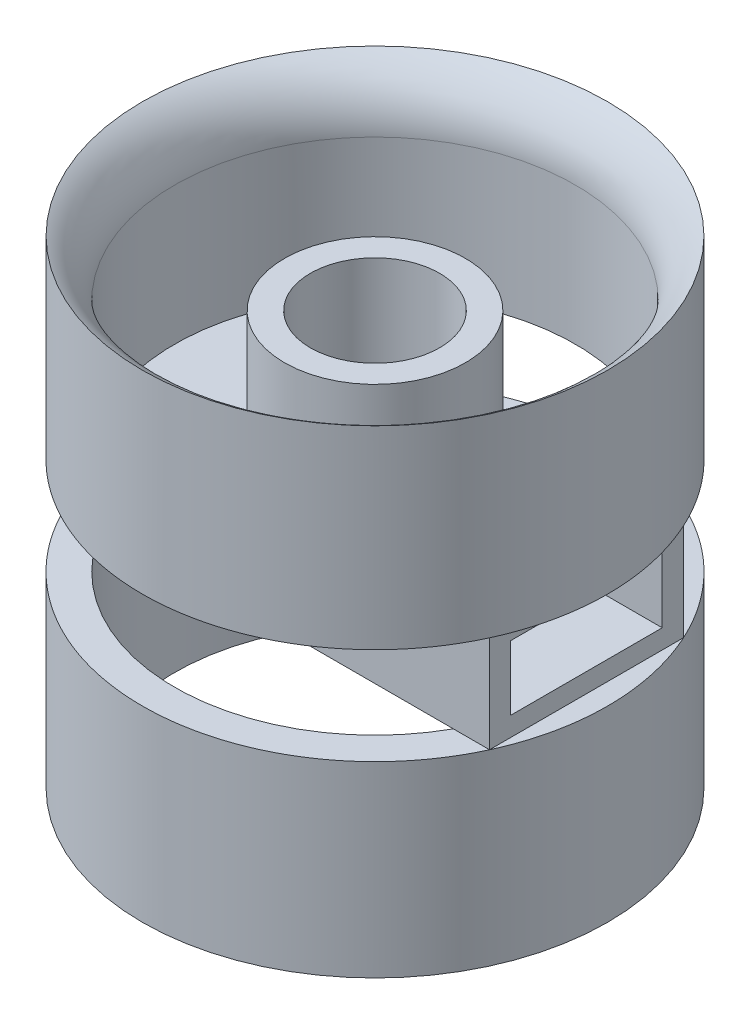
from build123d import *

# Parameters (mm, degrees)
SKETCH_1_R          = 36
EXTRUDE_1_DEPTH     = 30
SKETCH_2_R          = 31
CUT_EXTRUDE_1_DEPTH = 30
FILLET_1_R          = 10
SKETCH_11_W         = 65.4474843869366
SKETCH_11_H         = 30.000000000000004
EXTRUDE_8_DEPTH     = 15
CUT_EXTRUDE_3_DEPTH = 84.18024249227881
CUT_EXTRUDE_4_DEPTH = 58.00000000000003
SKETCH_21_R         = 14
EXTRUDE_10_DEPTH    = 20
SKETCH_22_R         = 10
CUT_EXTRUDE_5_DEPTH = 20
EXTRUDE_START       = 29.000000000000004
SKETCH_23_R         = 36
EXTRUDE_11_DEPTH    = 29.000000000000004
CUT_EXTRUDE_START   = -29
SKETCH_24_R         = 31
CUT_EXTRUDE_7_DEPTH = 29


with BuildPart() as part:
    # 草圖1 → 填料-伸長1 (new body)
    with BuildSketch(Plane(origin=(0, 0, 0), x_dir=(1, 0, 0), z_dir=(0, 1, 0))):
        with Locations(Location((0, 0, 0), (0, 0, 270))):
            Circle(SKETCH_1_R)
    extrude(amount=EXTRUDE_1_DEPTH)

    # 草圖2 → 除料-伸長1 (cut)
    with BuildSketch(Plane(origin=(0, 30, 0), x_dir=(1, 0, 0), z_dir=(0, 1, 0))):
        with Locations(Location((0, 0, 0), (0, 0, 270))):
            Circle(SKETCH_2_R)
    extrude(amount=-CUT_EXTRUDE_1_DEPTH, mode=Mode.SUBTRACT)

    # 圓角1
    # the kernel refuses this fillet: 10 mm, written as the material it takes off along each edge
    with BuildSketch(Plane(origin=(0, 30, 0), x_dir=(-1.8e-16, 0, 1), z_dir=(-1, 0, -1.8e-16))) as fillet_1_piece_1:
        with BuildLine():
            CenterArc((41, -8.660254037844858), FILLET_1_R, 119.99999999999864, 60.000000000001364)
            Line((31.000000000000004, -8.660254037844858), (30.800000000000004, -8.660254037844858))
            Line((30.800000000000004, -8.660254037844858), (30.8, 0))
            Line((30.8, 0), (31, 0.1999999999999993))
            ThreePointArc((31, 0.1999999999999993), (33.5000000000001, 0.1999999999999993), (35.90000000000021, 0.17320508075653507))
            Line((35.90000000000021, 0.17320508075653507), (36.000000000000206, -3.5527e-13))
        make_face()
    revolve(axis=Axis((0, 30, 0), (0, 1, 0)), mode=Mode.SUBTRACT)

    # 草圖11 → 填料-伸長8 (add)
    with BuildSketch(Plane(origin=(0, 0, 0), x_dir=(1, 0, 0), z_dir=(0, 1, 0))):
        Rectangle(SKETCH_11_W, SKETCH_11_H)
    extrude(amount=-EXTRUDE_8_DEPTH)

    # 草圖16 → 除料-伸長3 (cut, through all)
    with BuildSketch(Plane.ZY.offset(32.7237421934683)):
        Polygon((-11.724999999999989, -2.02034535171655), (11.725000000000014, -2.02034535171655), (11.725000000000014, -12.02034535171655), (-11.724999999999985, -12.02034535171655), align=None)
    extrude(amount=-CUT_EXTRUDE_3_DEPTH, mode=Mode.SUBTRACT)

    # 草圖19 → 除料-伸長4 (cut)
    with BuildSketch(Plane.ZY.offset(32.7237421934683)):
        Polygon((-11.72500000000632, -6.624703450403075), (-12.725000000017417, -6.624703450403075), (-12.725000000017417, -5.624703450403075), (-13.725000000017417, -5.624703450403075), (-13.725000000017417, -8.624839762103937), (-12.725000000017417, -8.624839762103937), (-12.725000000017417, -7.624703450403074), (-11.72500000000632, -7.624703450403074), align=None)
    extrude(amount=-CUT_EXTRUDE_4_DEPTH, mode=Mode.SUBTRACT)

    # 草圖21 → 填料-伸長10 (add)
    with BuildSketch(Plane(origin=(0, 0, 0), x_dir=(1, 0, 0), z_dir=(0, 1, 0))):
        with Locations(Location((0, 0, 0), (0, 0, 270))):
            Circle(SKETCH_21_R)
    extrude(amount=EXTRUDE_10_DEPTH)

    # 草圖22 → 除料-伸長5 (cut)
    with BuildSketch(Plane(origin=(0, 20, 0), x_dir=(1, 0, 0), z_dir=(0, 1, 0))):
        with Locations(Location((0, 0, 0), (0, 0, 270))):
            Circle(SKETCH_22_R)
    extrude(amount=-CUT_EXTRUDE_5_DEPTH, mode=Mode.SUBTRACT)

    # 草圖23 → 填料-伸長11 (add)
    with BuildSketch(Plane.XZ.offset(15).offset(EXTRUDE_START)):
        with Locations(Location((0, 0, 0), (0, 0, 90))):
            Circle(SKETCH_23_R)
    extrude(amount=-EXTRUDE_11_DEPTH)

    # 草圖24 → 除料-伸長7 (cut)
    with BuildSketch(Plane.XZ.offset(44.00000000000001).offset(CUT_EXTRUDE_START)):
        with Locations(Location((0, 0, 0), (0, 0, 90))):
            Circle(SKETCH_24_R)
    extrude(amount=CUT_EXTRUDE_7_DEPTH, mode=Mode.SUBTRACT)


solid = part.part
